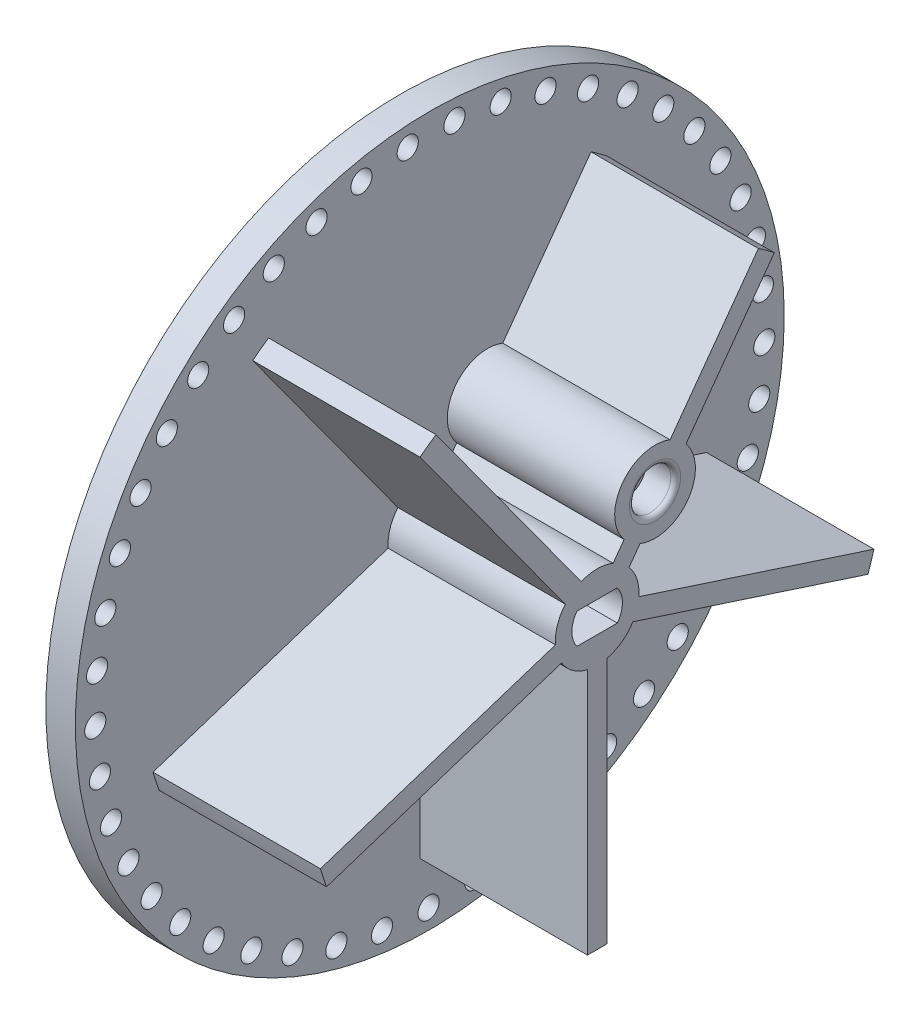
from build123d import *

# Parameters (mm, degrees)
SKETCH1_R                 = 36
SKETCH1_R_2               = 1.075
SKETCH1_R_3               = 4.25
BOSS_EXTRUDE1_DEPTH       = 3
SKETCH1_3_R               = 4.25
BOSS_EXTRUDE2_DEPTH       = 20
BOSS_EXTRUDE3_DEPTH       = 3
BOSS_EXTRUDE5_DEPTH       = 17
SKETCH3_R                 = 2.2
CUT_EXTRUDE1_DEPTH        = 10
BOSS_EXTRUDE6_DEPTH       = 17
CUT_EXTRUDE2_START        = 3
CUT_EXTRUDE2_DEPTH        = 17
BOSS_EXTRUDE7_START       = 3
BOSS_EXTRUDE7_OUTLINE_R   = 2.1
BOSS_EXTRUDE7_OUTLINE_R_2 = 0.1
BOSS_EXTRUDE7_DEPTH       = 14
FILLET1_R                 = 0.5


# Read off the part's stored shape, not the designer's step: Cut-Extrude2, Boss-Extrude7
with BuildPart() as part:
    # Sketch1 → Boss-Extrude1 (new body)
    with BuildSketch(Plane(origin=(0, 0, 0), x_dir=(0, 0, -1), z_dir=(1, 0, 0))):
        Circle(SKETCH1_R)
        with Locations((20.089039043, 27.430466826)):
            Circle(SKETCH1_R_2, mode=Mode.SUBTRACT)
        with Locations((23.711117025, 24.36766155)):
            Circle(SKETCH1_R_2, mode=Mode.SUBTRACT)
        with Locations((26.871685085, 20.830567459)):
            Circle(SKETCH1_R_2, mode=Mode.SUBTRACT)
        with Locations((29.509226361, 16.888030067)):
            Circle(SKETCH1_R_2, mode=Mode.SUBTRACT)
        with Locations((31.572404113, 12.61678638)):
            Circle(SKETCH1_R_2, mode=Mode.SUBTRACT)
        with Locations((33.021060931, 8.099971297)):
            Circle(SKETCH1_R_2, mode=Mode.SUBTRACT)
        with Locations((33.827000359, 3.425499486)):
            Circle(SKETCH1_R_2, mode=Mode.SUBTRACT)
        with Locations((33.974535702, -1.315645775)):
            Circle(SKETCH1_R_2, mode=Mode.SUBTRACT)
        with Locations((33.460795354, -6.031183488)):
            Circle(SKETCH1_R_2, mode=Mode.SUBTRACT)
        with Locations((32.295778685, -10.629331075)):
            Circle(SKETCH1_R_2, mode=Mode.SUBTRACT)
        with Locations((30.50216142, -15.020590824)):
            Circle(SKETCH1_R_2, mode=Mode.SUBTRACT)
        with Locations((28.114854279, -19.119491857)):
            Circle(SKETCH1_R_2, mode=Mode.SUBTRACT)
        with Locations((25.180323479, -22.84625373)):
            Circle(SKETCH1_R_2, mode=Mode.SUBTRACT)
        with Locations((21.755686325, -26.128339261)):
            Circle(SKETCH1_R_2, mode=Mode.SUBTRACT)
        with Locations((17.907599484, -28.901866388)):
            Circle(SKETCH1_R_2, mode=Mode.SUBTRACT)
        with Locations((13.710961588, -31.112851562)):
            Circle(SKETCH1_R_2, mode=Mode.SUBTRACT)
        with Locations((9.24745542, -32.718260471)):
            Circle(SKETCH1_R_2, mode=Mode.SUBTRACT)
        with Locations((4.603958052, -33.686845656)):
            Circle(SKETCH1_R_2, mode=Mode.SUBTRACT)
        with Locations((-0.129150123, -33.999754709)):
            Circle(SKETCH1_R_2, mode=Mode.SUBTRACT)
        with Locations((-4.859744537, -33.65089721)):
            Circle(SKETCH1_R_2, mode=Mode.SUBTRACT)
        with Locations((-9.495749552, -32.647063274)):
            Circle(SKETCH1_R_2, mode=Mode.SUBTRACT)
        with Locations((-13.946930604, -31.007791388)):
            Circle(SKETCH1_R_2, mode=Mode.SUBTRACT)
        with Locations((-18.126650515, -28.764988112)):
            Circle(SKETCH1_R_2, mode=Mode.SUBTRACT)
        with Locations((-21.953555793, -25.962307063)):
            Circle(SKETCH1_R_2, mode=Mode.SUBTRACT)
        with Locations((-25.353160079, -22.654299239)):
            Circle(SKETCH1_R_2, mode=Mode.SUBTRACT)
        with Locations((-28.259293943, -18.905351249)):
            Circle(SKETCH1_R_2, mode=Mode.SUBTRACT)
        with Locations((-30.615392795, -14.788432101)):
            Circle(SKETCH1_R_2, mode=Mode.SUBTRACT)
        with Locations((-32.375597851, -10.383672944)):
            Circle(SKETCH1_R_2, mode=Mode.SUBTRACT)
        with Locations((-33.505648721, -5.776807404)):
            Circle(SKETCH1_R_2, mode=Mode.SUBTRACT)
        with Locations((-33.983550251, -1.057502879)):
            Circle(SKETCH1_R_2, mode=Mode.SUBTRACT)
        with Locations((-33.800000631, 3.682384736)):
            Circle(SKETCH1_R_2, mode=Mode.SUBTRACT)
        with Locations((-32.958572446, 8.350598921)):
            Circle(SKETCH1_R_2, mode=Mode.SUBTRACT)
        with Locations((-31.475643138, 12.856278197)):
            Circle(SKETCH1_R_2, mode=Mode.SUBTRACT)
        with Locations((-29.380076239, 17.111724641)):
            Circle(SKETCH1_R_2, mode=Mode.SUBTRACT)
        with Locations((-26.712659575, 21.03411083)):
            Circle(SKETCH1_R_2, mode=Mode.SUBTRACT)
        with Locations((-23.525311378, 24.547091977)):
            Circle(SKETCH1_R_2, mode=Mode.SUBTRACT)
        with Locations((-19.880069755, 27.582291901)):
            Circle(SKETCH1_R_2, mode=Mode.SUBTRACT)
        with Locations((-15.847885187, 30.080633888)):
            Circle(SKETCH1_R_2, mode=Mode.SUBTRACT)
        with Locations((-11.507239561, 31.993490552)):
            Circle(SKETCH1_R_2, mode=Mode.SUBTRACT)
        with Locations((-6.942618606, 33.283630314)):
            Circle(SKETCH1_R_2, mode=Mode.SUBTRACT)
        with Locations((-2.242867477, 33.925942072)):
            Circle(SKETCH1_R_2, mode=Mode.SUBTRACT)
        with Locations((2.500538516, 33.907923958)):
            Circle(SKETCH1_R_2, mode=Mode.SUBTRACT)
        with Locations((7.195274371, 33.229926673)):
            Circle(SKETCH1_R_2, mode=Mode.SUBTRACT)
        with Locations((11.749962396, 31.905146665)):
            Circle(SKETCH1_R_2, mode=Mode.SUBTRACT)
        with Locations((16.075950767, 29.959369268)):
            Circle(SKETCH1_R_2, mode=Mode.SUBTRACT)
        Circle(SKETCH1_R_3, mode=Mode.SUBTRACT)
    extrude(amount=BOSS_EXTRUDE1_DEPTH)

    # Sketch1<3> → Boss-Extrude2 (add)
    with BuildSketch(Plane(origin=(0, 0, 0), x_dir=(0, 0, -1), z_dir=(1, 0, 0))):
        Circle(SKETCH1_3_R)
        with BuildLine():
            ThreePointArc((2.05, -1.55), (2.570019455, 0), (2.05, 1.55))
            Line((2.05, 1.55), (-2.05, 1.55))
            ThreePointArc((-2.05, 1.55), (-2.570019455, 0), (-2.05, -1.55))
            Line((-2.05, -1.55), (2.05, -1.55))
        make_face(mode=Mode.SUBTRACT)
    extrude(amount=BOSS_EXTRUDE2_DEPTH)

    # Sketch1<4> → Boss-Extrude3 (add)
    with BuildSketch(Plane(origin=(0, 0, 0), x_dir=(0, 0, -1), z_dir=(1, 0, 0))):
        with BuildLine():
            Line((-2.05, -1.55), (2.05, -1.55))
            ThreePointArc((2.05, -1.55), (2.570019455, 0), (2.05, 1.55))
            Line((2.05, 1.55), (-2.05, 1.55))
            ThreePointArc((-2.05, 1.55), (-2.570019455, 0), (-2.05, -1.55))
        make_face()
    extrude(amount=BOSS_EXTRUDE3_DEPTH)

    # Sketch2 → Boss-Extrude5 (add)
    with BuildSketch(Plane(origin=(3, 0, 0), x_dir=(0, 0, -1), z_dir=(1, 0, 0))):
        with BuildLine():
            Line((-27.493123978, -9.984519716), (-3.619491149, -2.227506189))
            ThreePointArc((-3.619491149, -2.227506189), (-4.041990194, -1.313322226), (-4.237525138, -0.325393156))
            Line((-4.237525138, -0.325393156), (-28.111157966, -8.082406683))
            ThreePointArc((-28.111157966, -8.082406683), (-27.818403102, -9.038747085), (-27.493123978, -9.984519716))
        make_face()
        with BuildLine():
            ThreePointArc((1.618934563, 3.92957388), (2.498087322, 3.438322226), (3.236968552, 2.754003376))
            Line((3.236968552, 2.754003376), (17.991685075, 23.062128439))
            ThreePointArc((17.991685075, 23.062128439), (17.19271863, 23.663747085), (16.373651086, 24.237698944))
            Line((16.373651086, 24.237698944), (1.618934563, 3.92957388))
        make_face()
        with BuildLine():
            ThreePointArc((4.237525138, -0.325393156), (4.041990194, -1.313322226), (3.619491149, -2.227506189))
            Line((3.619491149, -2.227506189), (27.493123978, -9.984519716))
            ThreePointArc((27.493123978, -9.984519716), (27.818403102, -9.038747085), (28.111157966, -8.082406683))
            Line((28.111157966, -8.082406683), (4.237525138, -0.325393156))
        make_face()
        with BuildLine():
            ThreePointArc((1, -4.13067791), (0, -4.25), (-1, -4.13067791))
            Line((-1, -4.13067791), (-1, -29.232900985))
            ThreePointArc((-1, -29.232900985), (0, -29.25), (1, -29.232900985))
            Line((1, -29.232900985), (1, -4.13067791))
        make_face()
        with BuildLine():
            Line((-3.236968552, 2.754003376), (-17.991685075, 23.062128439))
            ThreePointArc((-17.991685075, 23.062128439), (-17.19271863, 23.663747085), (-16.373651086, 24.237698944))
            Line((-16.373651086, 24.237698944), (-1.618934563, 3.92957388))
            ThreePointArc((-1.618934563, 3.92957388), (-2.498087322, 3.438322226), (-3.236968552, 2.754003376))
        make_face()
    extrude(amount=BOSS_EXTRUDE5_DEPTH)

    # Sketch3 → Cut-Extrude1 (cut)
    with BuildSketch(Plane.ZY):
        Circle(SKETCH3_R)
    extrude(amount=-CUT_EXTRUDE1_DEPTH, mode=Mode.SUBTRACT)

    # Sketch6 → Boss-Extrude6 (add)
    with BuildSketch(Plane(origin=(3, 0, 0), x_dir=(0, 0, -1), z_dir=(1, 0, 0))):
        with BuildLine():
            ThreePointArc((9.977852523, 8.090169944), (9.530979272, 9.951530993), (8.287772057, 11.407139621))
            Line((8.287772057, 11.407139621), (7.112201553, 9.789105632))
            ThreePointArc((7.112201553, 9.789105632), (7.748966224, 9.043549993), (7.977852523, 8.090169944))
            ThreePointArc((7.977852523, 8.090169944), (6.831232572, 6.219056243), (4.643503493, 6.391234256))
            Line((4.643503493, 6.391234256), (3.467932989, 4.773200267))
            ThreePointArc((3.467932989, 4.773200267), (7.739213572, 4.437043195), (9.977852523, 8.090169944))
        make_face()
        with BuildLine():
            Line((7.112201553, 9.789105632), (8.287772057, 11.407139621))
            ThreePointArc((8.287772057, 11.407139621), (2.560882846, 10.500089478), (3.467932989, 4.773200267))
            Line((3.467932989, 4.773200267), (4.643503493, 6.391234256))
            ThreePointArc((4.643503493, 6.391234256), (4.178916835, 9.324518974), (7.112201553, 9.789105632))
        make_face()
    extrude(amount=BOSS_EXTRUDE6_DEPTH)

    # Cut-Extrude2 outline → Cut-Extrude2 (cut)
    with BuildSketch(Plane.YZ.offset(CUT_EXTRUDE2_START)):
        with BuildLine():
            Line((10.17190097, -6.154250668), (7.184009422, -3.983420389))
            ThreePointArc((7.184009422, -3.983420389), (6.391234256, -4.643503493), (6.008438918, -5.601454378))
            Line((6.008438918, -5.601454378), (8.996330465, -7.772284657))
            ThreePointArc((8.996330465, -7.772284657), (9.789105632, -7.112201553), (10.17190097, -6.154250668))
        make_face()
    extrude(amount=CUT_EXTRUDE2_DEPTH, mode=Mode.SUBTRACT)

    # Boss-Extrude7 outline → Boss-Extrude7 (add)
    with BuildSketch(Plane.YZ.offset(BOSS_EXTRUDE7_START)):
        with Locations((8.090169944, -5.877852523)):
            Circle(BOSS_EXTRUDE7_OUTLINE_R)
        with Locations((8.090169944, -5.877852523)):
            Circle(BOSS_EXTRUDE7_OUTLINE_R_2, mode=Mode.SUBTRACT)
    extrude(amount=BOSS_EXTRUDE7_DEPTH)

    # Fillet1
    fillet1_edges = [part.edges().sort_by_distance(p)[0] for p in [
        (20, 6.855820914, -7.576788211),
    ]]
    fillet(fillet1_edges, radius=FILLET1_R)


solid = part.part
